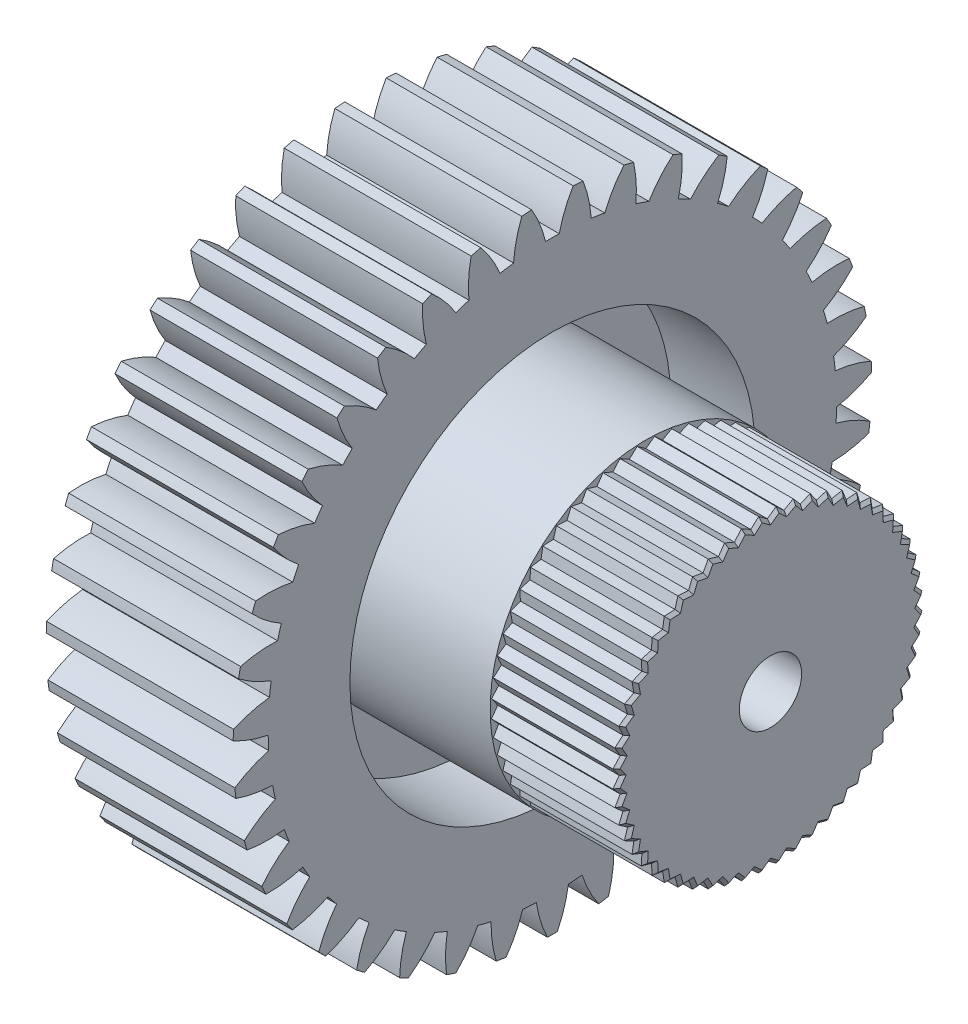
from build123d import *

# Parameters (mm, degrees)
CUT_EXTRUDE1_START         = -3
CUT_EXTRUDE1_OUTLINE_R     = 3.25
CUT_EXTRUDE1_DEPTH         = 3
CUT_EXTRUDE1_2_OUTLINE_R   = 3.25
CUT_EXTRUDE1_2_OUTLINE_R_2 = 0.5
CUT_EXTRUDE1_2_DEPTH       = 1.65
BOSS_EXTRUDE1_DEPTH        = 3.5
BOSS_EXTRUDE1_DEPTH_BACK   = 1.35
SKETCH1_3_R                = 2.5
CUT_EXTRUDE2_START         = 12.698683895
CUT_EXTRUDE2_DEPTH         = 14.698683895
CIRPATTERN1_COUNT          = 56
CHAMFER1_SIZE              = 0.05
SKETCH3_R                  = 0.5
CUT_EXTRUDE3_DEPTH         = 11.868841009


with BuildPart() as part:
    # Cut-Extrude1: read off the stored shape, not the designer's step
    # Cut-Extrude1 outline → Cut-Extrude1 (new body)
    with BuildSketch(Plane(origin=(-2.041991576, 0, 0), x_dir=(0, 0, -1), z_dir=(1, 0, 0)).offset(CUT_EXTRUDE1_START)):
        with BuildLine():
            ThreePointArc((-4.542003654, 3.054318536), (-4.545821817, 2.974892192), (-4.5484072, 2.895416169))
            ThreePointArc((-4.5484072, 2.895416169), (-4.274874018, 2.773395648), (-3.985880759, 2.694704447))
            ThreePointArc((-3.985880759, 2.694704447), (-3.982778816, 2.584856163), (-3.977031586, 2.47511448))
            ThreePointArc((-3.977031586, 2.47511448), (-4.258755718, 2.373424154), (-4.521583343, 2.229789032))
            ThreePointArc((-4.521583343, 2.229789032), (-4.512611181, 2.150778762), (-4.502414234, 2.071917208))
            ThreePointArc((-4.502414234, 2.071917208), (-4.212849767, 1.99535463), (-3.914975938, 1.964040238))
            ThreePointArc((-3.914975938, 1.964040238), (-3.89429326, 1.856112047), (-3.871016652, 1.74871341))
            ThreePointArc((-3.871016652, 1.74871341), (-4.132780255, 1.603148219), (-4.369163637, 1.419212618))
            ThreePointArc((-4.369163637, 1.419212618), (-4.347633523, 1.342664746), (-4.324918341, 1.266460134))
            ThreePointArc((-4.324918341, 1.266460134), (-4.026822157, 1.237338427), (-3.727782534, 1.254211871))
            ThreePointArc((-3.727782534, 1.254211871), (-3.690054792, 1.150999057), (-3.649851656, 1.048725035))
            ThreePointArc((-3.649851656, 1.048725035), (-3.884875191, 0.86305504), (-4.088692125, 0.643582795))
            ThreePointArc((-4.088692125, 0.643582795), (-4.055161678, 0.571479872), (-4.020516572, 0.499905861))
            ThreePointArc((-4.020516572, 0.499905861), (-3.721609205, 0.518979263), (-3.429148758, 0.583603529))
            ThreePointArc((-3.429148758, 0.583603529), (-3.37535308, 0.487779249), (-3.319264658, 0.393278685))
            ThreePointArc((-3.319264658, 0.393278685), (-3.521461138, 0.172312641), (-3.687432872, -0.077012031))
            ThreePointArc((-3.687432872, -0.077012031), (-3.642770514, -0.142802579), (-3.597092774, -0.207892259))
            ThreePointArc((-3.597092774, -0.207892259), (-3.305115768, -0.141117738), (-3.026809068, -0.030416384))
            ThreePointArc((-3.026809068, -0.030416384), (-2.958338734, -0.116370331), (-2.887817686, -0.200649922))
            ThreePointArc((-2.887817686, -0.200649922), (-3.051950328, -0.45118911), (-3.175778283, -0.723908832))
            ThreePointArc((-3.175778283, -0.723908832), (-3.121140744, -0.781683063), (-3.065613399, -0.838602624))
            ThreePointArc((-3.065613399, -0.838602624), (-2.788128805, -0.725856411), (-2.53118385, -0.571945076))
            ThreePointArc((-2.53118385, -0.571945076), (-2.449812206, -0.645802529), (-2.36668499, -0.717678349))
            ThreePointArc((-2.36668499, -0.717678349), (-2.488502846, -0.991301847), (-2.566979941, -1.280353321))
            ThreePointArc((-2.566979941, -1.280353321), (-2.503782306, -1.328614914), (-2.439843486, -1.375890169))
            ThreePointArc((-2.439843486, -1.375890169), (-2.184038009, -1.22009233), (-1.955109537, -1.026957238))
            ThreePointArc((-1.955109537, -1.026957238), (-1.862944067, -1.086805326), (-1.769363634, -1.14441583))
            ThreePointArc((-1.769363634, -1.14441583), (-1.845711684, -1.434036935), (-1.876805404, -1.731933879))
            ThreePointArc((-1.876805404, -1.731933879), (-1.806684458, -1.769432883), (-1.735990145, -1.805839428))
            ThreePointArc((-1.735990145, -1.805839428), (-1.508489012, -1.611025046), (-1.313506152, -1.383668293))
            ThreePointArc((-1.313506152, -1.383668293), (-1.212933892, -1.427956983), (-1.111323926, -1.469810089))
            ThreePointArc((-1.111323926, -1.469810089), (-1.140224797, -1.767927765), (-1.123129831, -2.066954806))
            ThreePointArc((-1.123129831, -2.066954806), (-1.047901669, -2.092720016), (-0.972282808, -2.117314941))
            ThreePointArc((-0.972282808, -2.117314941), (-0.77897818, -1.888529606), (-0.622990885, -1.632839613))
            ThreePointArc((-0.622990885, -1.632839613), (-0.516616604, -1.660421851), (-0.40960875, -1.685433586))
            ThreePointArc((-0.40960875, -1.685433586), (-0.390313924, -1.984326742), (-0.325473023, -2.276739235))
            ThreePointArc((-0.325473023, -2.276739235), (-0.247086016, -2.290103347), (-0.168501096, -2.302249656))
            ThreePointArc((-0.168501096, -2.302249656), (-0.01439946, -2.045418788), (0.098552281, -1.768017791))
            ThreePointArc((0.098552281, -1.768017791), (0.207973546, -1.778179212), (0.31760784, -1.785701784))
            ThreePointArc((0.31760784, -1.785701784), (0.384598637, -2.077629244), (0.495506128, -2.355853861))
            ThreePointArc((0.495506128, -2.355853861), (0.575021799, -2.356470751), (0.65453747, -2.355853861))
            ThreePointArc((0.65453747, -2.355853861), (0.765444961, -2.077629244), (0.832435758, -1.785701784))
            ThreePointArc((0.832435758, -1.785701784), (0.942070052, -1.778179212), (1.051491317, -1.768017791))
            ThreePointArc((1.051491317, -1.768017791), (1.164443059, -2.045418788), (1.318544694, -2.302249656))
            ThreePointArc((1.318544694, -2.302249656), (1.397129614, -2.290103347), (1.475516621, -2.276739235))
            ThreePointArc((1.475516621, -2.276739235), (1.540357522, -1.984326742), (1.559652348, -1.685433586))
            ThreePointArc((1.559652348, -1.685433586), (1.666660202, -1.660421851), (1.773034483, -1.632839613))
            ThreePointArc((1.773034483, -1.632839613), (1.929021779, -1.888529606), (2.122326407, -2.117314941))
            ThreePointArc((2.122326407, -2.117314941), (2.197945267, -2.092720016), (2.273173429, -2.066954806))
            ThreePointArc((2.273173429, -2.066954806), (2.290268395, -1.767927765), (2.261367524, -1.469810089))
            ThreePointArc((2.261367524, -1.469810089), (2.36297749, -1.427956983), (2.46354975, -1.383668293))
            ThreePointArc((2.46354975, -1.383668293), (2.65853261, -1.611025046), (2.886033743, -1.805839428))
            ThreePointArc((2.886033743, -1.805839428), (2.956728056, -1.769432883), (3.026849002, -1.731933879))
            ThreePointArc((3.026849002, -1.731933879), (2.995755282, -1.434036935), (2.919407232, -1.14441583))
            ThreePointArc((2.919407232, -1.14441583), (3.012987665, -1.086805326), (3.105153135, -1.026957238))
            ThreePointArc((3.105153135, -1.026957238), (3.334081607, -1.22009233), (3.589887084, -1.375890169))
            ThreePointArc((3.589887084, -1.375890169), (3.653825904, -1.328614914), (3.717023539, -1.280353321))
            ThreePointArc((3.717023539, -1.280353321), (3.638546444, -0.991301847), (3.516728588, -0.717678349))
            ThreePointArc((3.516728588, -0.717678349), (3.599855805, -0.645802529), (3.681227448, -0.571945076))
            ThreePointArc((3.681227448, -0.571945076), (3.938172403, -0.725856411), (4.215656998, -0.838602624))
            ThreePointArc((4.215656998, -0.838602624), (4.271184342, -0.781683063), (4.325821881, -0.723908832))
            ThreePointArc((4.325821881, -0.723908832), (4.201993926, -0.45118911), (4.037861284, -0.200649922))
            ThreePointArc((4.037861284, -0.200649922), (4.108382332, -0.116370331), (4.176852666, -0.030416384))
            ThreePointArc((4.176852666, -0.030416384), (4.455159366, -0.141117738), (4.747136372, -0.207892259))
            ThreePointArc((4.747136372, -0.207892259), (4.792814112, -0.142802578), (4.837476471, -0.077012031))
            ThreePointArc((4.837476471, -0.077012031), (4.671504736, 0.172312641), (4.469308256, 0.393278685))
            ThreePointArc((4.469308256, 0.393278685), (4.525396678, 0.487779249), (4.579192356, 0.583603529))
            ThreePointArc((4.579192356, 0.583603529), (4.871652803, 0.518979263), (5.17056017, 0.499905861))
            ThreePointArc((5.17056017, 0.499905861), (5.205205276, 0.571479872), (5.238735723, 0.643582795))
            ThreePointArc((5.238735723, 0.643582795), (5.034918789, 0.86305504), (4.799895255, 1.048725035))
            ThreePointArc((4.799895255, 1.048725035), (4.84009839, 1.150999057), (4.877826132, 1.254211871))
            ThreePointArc((4.877826132, 1.254211871), (5.176865755, 1.237338427), (5.474961939, 1.266460134))
            ThreePointArc((5.474961939, 1.266460134), (5.497677121, 1.342664746), (5.519207235, 1.419212618))
            ThreePointArc((5.519207235, 1.419212618), (5.282823853, 1.603148219), (5.02106025, 1.74871341))
            ThreePointArc((5.02106025, 1.74871341), (5.044336858, 1.856112047), (5.065019536, 1.964040238))
            ThreePointArc((5.065019536, 1.964040238), (5.362893365, 1.99535463), (5.652457832, 2.071917208))
            ThreePointArc((5.652457832, 2.071917208), (5.662654779, 2.150778762), (5.671626942, 2.229789032))
            ThreePointArc((5.671626942, 2.229789032), (5.408799316, 2.373424154), (5.127075184, 2.47511448))
            ThreePointArc((5.127075184, 2.47511448), (5.132822414, 2.584856163), (5.135924358, 2.694704447))
            ThreePointArc((5.135924358, 2.694704447), (5.424917617, 2.773395648), (5.698450798, 2.895416169))
            ThreePointArc((5.698450798, 2.895416169), (5.695865415, 2.974892192), (5.692047252, 3.054318536))
            ThreePointArc((5.692047252, 3.054318536), (5.409582482, 3.153933105), (5.115194328, 3.209114838))
            ThreePointArc((5.115194328, 3.209114838), (5.103263328, 3.318357316), (5.088704198, 3.427280681))
            ThreePointArc((5.088704198, 3.427280681), (5.361332114, 3.55131063), (5.611749645, 3.715628825))
            ThreePointArc((5.611749645, 3.715628825), (5.596448891, 3.793660929), (5.579939291, 3.871446246))
            ThreePointArc((5.579939291, 3.871446246), (5.285153064, 3.924460297), (4.985725387, 3.931704261))
            ThreePointArc((4.985725387, 3.931704261), (4.956425165, 4.037618211), (4.924582036, 4.142795598))
            ThreePointArc((4.924582036, 4.142795598), (5.173783689, 4.308951985), (5.394599886, 4.511312099))
            ThreePointArc((5.394599886, 4.511312099), (5.366980043, 4.585879295), (5.338206595, 4.660008986))
            ThreePointArc((5.338206595, 4.660008986), (5.038733721, 4.665049483), (4.74202154, 4.624168062))
            ThreePointArc((4.74202154, 4.624168062), (4.696110957, 4.724010368), (4.647808548, 4.822717738))
            ThreePointArc((4.647808548, 4.822717738), (4.867129746, 5.0266972), (5.052625586, 5.261858213))
            ThreePointArc((5.052625586, 5.261858213), (5.013401993, 5.331029249), (4.973109916, 5.399583395))
            ThreePointArc((4.973109916, 5.399583395), (4.676706584, 5.356519791), (4.390394589, 5.268571793))
            ThreePointArc((4.390394589, 5.268571793), (4.329062703, 5.359756591), (4.265552022, 5.449437476))
            ThreePointArc((4.265552022, 5.449437476), (4.449312462, 5.685957052), (4.594683701, 5.947828417))
            ThreePointArc((4.594683701, 5.947828417), (4.544872228, 6.009811799), (4.494105064, 6.071014883))
            ThreePointArc((4.494105064, 6.071014883), (4.208447966, 5.980962503), (3.939951487, 5.848225735))
            ThreePointArc((3.939951487, 5.848225735), (3.864786763, 5.928391387), (3.787712703, 6.006723098))
            ThreePointArc((3.787712703, 6.006723098), (3.931153085, 6.269657055), (4.032634683, 6.551456442))
            ThreePointArc((4.032634683, 6.551456442), (3.973525423, 6.604646833), (3.913598015, 6.656913727))
            ThreePointArc((3.913598015, 6.656913727), (3.646085518, 6.522204882), (3.402358473, 6.348117155))
            ThreePointArc((3.402358473, 6.348117155), (3.315307637, 6.415187414), (3.226666376, 6.480141201))
            ThreePointArc((3.226666376, 6.480141201), (3.32607167, 6.762679688), (3.381035308, 7.057108639))
            ThreePointArc((3.381035308, 7.057108639), (3.314159158, 7.100128437), (3.246623595, 7.142105457))
            ThreePointArc((3.246623595, 7.142105457), (3.004184134, 6.966229033), (2.791538925, 6.755299129))
            ThreePointArc((2.791538925, 6.755299129), (2.694856548, 6.80753691), (2.596943848, 6.857430504))
            ThreePointArc((2.596943848, 6.857430504), (2.649739509, 7.152255922), (2.656761657, 7.451688884))
            ThreePointArc((2.656761657, 7.451688884), (2.583850675, 7.483423898), (2.510456092, 7.514023859))
            ThreePointArc((2.510456092, 7.514023859), (2.29936872, 7.301534965), (2.123312747, 7.059225858))
            ThreePointArc((2.123312747, 7.059225858), (2.019502853, 7.095278229), (1.914854601, 7.128819413))
            ThreePointArc((1.914854601, 7.128819413), (1.919673249, 7.428295938), (1.878572037, 7.724977753))
            ThreePointArc((1.878572037, 7.724977753), (1.801514579, 7.744606063), (1.724161857, 7.763036444))
            ThreePointArc((1.724161857, 7.763036444), (1.549893628, 7.519438429), (1.414986647, 7.252025798))
            ThreePointArc((1.414986647, 7.252025798), (1.306737857, 7.270959022), (1.198064388, 7.287279096))
            ThreePointArc((1.198064388, 7.287279096), (1.154781223, 7.583650445), (1.066621151, 7.86989721))
            ThreePointArc((1.066621151, 7.86989721), (0.987412964, 7.876910453), (0.908105499, 7.882693917))
            ThreePointArc((0.908105499, 7.882693917), (0.775169867, 7.614295842), (0.684905899, 7.328705532))
            ThreePointArc((0.684905899, 7.328705532), (0.575021799, 7.330029249), (0.465137699, 7.328705532))
            ThreePointArc((0.465137699, 7.328705532), (0.374873732, 7.614295842), (0.241938099, 7.882693917))
            ThreePointArc((0.241938099, 7.882693917), (0.162630634, 7.876910453), (0.083422448, 7.86989721))
            ThreePointArc((0.083422448, 7.86989721), (-0.004737624, 7.583650445), (-0.04802079, 7.287279096))
            ThreePointArc((-0.04802079, 7.287279096), (-0.156694259, 7.270959022), (-0.264943049, 7.252025798))
            ThreePointArc((-0.264943049, 7.252025798), (-0.399850029, 7.519438429), (-0.574118259, 7.763036444))
            ThreePointArc((-0.574118259, 7.763036444), (-0.65147098, 7.744606063), (-0.728528439, 7.724977753))
            ThreePointArc((-0.728528439, 7.724977753), (-0.769629651, 7.428295938), (-0.764811003, 7.128819413))
            ThreePointArc((-0.764811003, 7.128819413), (-0.869459255, 7.095278229), (-0.973269149, 7.059225858))
            ThreePointArc((-0.973269149, 7.059225858), (-1.149325122, 7.301534965), (-1.360412494, 7.514023859))
            ThreePointArc((-1.360412494, 7.514023859), (-1.433807077, 7.483423898), (-1.506718059, 7.451688884))
            ThreePointArc((-1.506718059, 7.451688884), (-1.499695911, 7.152255922), (-1.44690025, 6.857430504))
            ThreePointArc((-1.44690025, 6.857430504), (-1.54481295, 6.80753691), (-1.641495327, 6.755299129))
            ThreePointArc((-1.641495327, 6.755299129), (-1.854140535, 6.966229033), (-2.096579997, 7.142105457))
            ThreePointArc((-2.096579997, 7.142105457), (-2.16411556, 7.100128437), (-2.23099171, 7.057108639))
            ThreePointArc((-2.23099171, 7.057108639), (-2.176028072, 6.762679688), (-2.076622778, 6.480141201))
            ThreePointArc((-2.076622778, 6.480141201), (-2.165264039, 6.415187414), (-2.252314875, 6.348117155))
            ThreePointArc((-2.252314875, 6.348117155), (-2.49604192, 6.522204882), (-2.763554417, 6.656913727))
            ThreePointArc((-2.763554417, 6.656913727), (-2.823481824, 6.604646833), (-2.882591085, 6.551456442))
            ThreePointArc((-2.882591085, 6.551456442), (-2.781109486, 6.269657056), (-2.637669105, 6.006723098))
            ThreePointArc((-2.637669105, 6.006723098), (-2.714743164, 5.928391387), (-2.789907889, 5.848225735))
            ThreePointArc((-2.789907889, 5.848225735), (-3.058404368, 5.980962503), (-3.344061466, 6.071014883))
            ThreePointArc((-3.344061466, 6.071014883), (-3.39482863, 6.009811799), (-3.444640102, 5.947828417))
            ThreePointArc((-3.444640102, 5.947828417), (-3.299268864, 5.685957052), (-3.115508424, 5.449437476))
            ThreePointArc((-3.115508424, 5.449437476), (-3.179019105, 5.359756591), (-3.240350991, 5.268571793))
            ThreePointArc((-3.240350991, 5.268571793), (-3.526662986, 5.356519791), (-3.823066318, 5.399583395))
            ThreePointArc((-3.823066318, 5.399583395), (-3.863358395, 5.331029249), (-3.902581988, 5.261858213))
            ThreePointArc((-3.902581988, 5.261858213), (-3.717086148, 5.0266972), (-3.49776495, 4.822717738))
            ThreePointArc((-3.49776495, 4.822717738), (-3.546067358, 4.724010367), (-3.591977942, 4.624168062))
            ThreePointArc((-3.591977942, 4.624168062), (-3.888690123, 4.665049483), (-4.188162997, 4.660008986))
            ThreePointArc((-4.188162997, 4.660008986), (-4.216936445, 4.585879295), (-4.244556288, 4.511312099))
            ThreePointArc((-4.244556288, 4.511312099), (-4.023740091, 4.308951985), (-3.774538438, 4.142795598))
            ThreePointArc((-3.774538438, 4.142795598), (-3.806381567, 4.037618211), (-3.835681789, 3.931704261))
            ThreePointArc((-3.835681789, 3.931704261), (-4.135109466, 3.924460297), (-4.429895692, 3.871446246))
            ThreePointArc((-4.429895692, 3.871446246), (-4.446405293, 3.793660929), (-4.461706047, 3.715628825))
            ThreePointArc((-4.461706047, 3.715628825), (-4.211288516, 3.55131063), (-3.9386606, 3.427280681))
            ThreePointArc((-3.9386606, 3.427280681), (-3.95321973, 3.318357316), (-3.965150729, 3.209114838))
            ThreePointArc((-3.965150729, 3.209114838), (-4.259538883, 3.153933105), (-4.542003654, 3.054318536))
        make_face()
        with Locations((0.575021799, 2.768529249)):
            Circle(CUT_EXTRUDE1_OUTLINE_R, mode=Mode.SUBTRACT)
    extrude(amount=CUT_EXTRUDE1_DEPTH)

    # Cut-Extrude1 2 outline → Cut-Extrude1 2 (add)
    with BuildSketch(Plane(origin=(-2.041991576, 0, 0), x_dir=(0, 0, -1), z_dir=(1, 0, 0)).offset(CUT_EXTRUDE1_START)):
        with Locations((0.575021799, 2.768529249)):
            Circle(CUT_EXTRUDE1_2_OUTLINE_R)
        with Locations((0.575021799, 2.768529249)):
            Circle(CUT_EXTRUDE1_2_OUTLINE_R_2, mode=Mode.SUBTRACT)
    extrude(amount=CUT_EXTRUDE1_2_DEPTH)

    # Sketch1<3> → Boss-Extrude1 (add, two sides: drawn at the far end of the back side and taken through both)
    with BuildSketch(Plane(origin=(-2.041991576, 0, 0), x_dir=(0, 0, -1), z_dir=(1, 0, 0)).offset(-BOSS_EXTRUDE1_DEPTH_BACK)):
        with Locations((0.575021799, 2.768529249)):
            Circle(SKETCH1_3_R)
    extrude(amount=BOSS_EXTRUDE1_DEPTH + BOSS_EXTRUDE1_DEPTH_BACK)

    # Sketch2 → Cut-Extrude2 (cut)
    with BuildSketch(Plane(origin=(1.458008424, 0, 0), x_dir=(0, 0, -1), z_dir=(1, 0, 0)).offset(CUT_EXTRUDE2_START)):
        with BuildLine():
            Line((0.412975905, 5.263271947), (0.575021799, 5.146049388))
            Line((0.575021799, 5.146049388), (0.737067693, 5.263271947))
            ThreePointArc((0.737067693, 5.263271947), (0.575021799, 5.268529249), (0.412975905, 5.263271947))
        make_face()
    cut_extrude2 = extrude(amount=-CUT_EXTRUDE2_DEPTH, mode=Mode.SUBTRACT)

    # CirPattern1: Cut-Extrude2 ×56 about axis
    cirpattern1_axis = Axis((-3.391991576, 2.768529249, -0.575021799), (1, 0, 0))
    for i in range(1, CIRPATTERN1_COUNT):
        add(cut_extrude2.rotate(cirpattern1_axis, i * 360 / CIRPATTERN1_COUNT), mode=Mode.SUBTRACT)

    # Chamfer1
    chamfer1_edges = [part.edges().sort_by_distance(p)[0] for p in [
        (1.458008424, 4.227869361, 1.366540516),
        (1.458008424, 4.119148069, 1.443682386),
        (1.458008424, 4.001307329, 1.517726631),
        (1.458008424, 3.884632505, 1.582210527),
        (1.458008424, 3.759242398, 1.64259522),
        (1.458008424, 3.636081295, 1.693610219),
        (1.458008424, 3.504718674, 1.739575988),
        (1.458008424, 3.376620114, 1.776480547),
        (1.458008424, 3.240936941, 1.807449346),
        (1.458008424, 3.109511838, 1.829779369),
        (1.458008424, 2.971214407, 1.845361748),
        (1.458008424, 2.838115508, 1.852836421),
        (1.458008424, 2.698942989, 1.852836421),
        (1.458008424, 2.565844091, 1.845361748),
        (1.458008424, 2.427546659, 1.829779369),
        (1.458008424, 2.296121557, 1.807449346),
        (1.458008424, 2.160438383, 1.776480547),
        (1.458008424, 2.032339824, 1.739575988),
        (1.458008424, 1.900977203, 1.693610219),
        (1.458008424, 1.7778161, 1.64259522),
        (1.458008424, 1.652425993, 1.582210527),
        (1.458008424, 1.535751168, 1.517726631),
        (1.458008424, 1.417910428, 1.443682386),
        (1.458008424, 1.309189136, 1.366540516),
        (1.458008424, 1.20037968, 1.279767869),
        (1.458008424, 1.100979153, 1.190938128),
        (1.458008424, 1.002569321, 1.092528296),
        (1.458008424, 0.91373958, 0.99312777),
        (1.458008424, 0.826966934, 0.884318313),
        (1.458008424, 0.749825063, 0.775597021),
        (1.458008424, 0.675780819, 0.657756282),
        (1.458008424, 0.611296923, 0.541081457),
        (1.458008424, 0.55091223, 0.41569135),
        (1.458008424, 0.499897231, 0.292530247),
        (1.458008424, 0.453931462, 0.161167626),
        (1.458008424, 0.417026902, 0.033069066),
        (1.458008424, 0.386058103, -0.102614107),
        (1.458008424, 0.36372808, -0.23403921),
        (1.458008424, 0.348145702, -0.372336641),
        (1.458008424, 0.340671028, -0.50543554),
        (1.458008424, 0.340671028, -0.644608059),
        (1.458008424, 0.348145702, -0.777706957),
        (1.458008424, 0.36372808, -0.916004389),
        (1.458008424, 0.386058103, -1.047429491),
        (1.458008424, 0.417026902, -1.183112665),
        (1.458008424, 0.453931462, -1.311211224),
        (1.458008424, 0.499897231, -1.442573845),
        (1.458008424, 0.55091223, -1.565734948),
        (1.458008424, 0.611296923, -1.691125055),
        (1.458008424, 0.675780819, -1.80779988),
        (1.458008424, 0.749825063, -1.92564062),
        (1.458008424, 0.826966934, -2.034361911),
        (1.458008424, 0.91373958, -2.143171368),
        (1.458008424, 1.002569321, -2.242571895),
        (1.458008424, 1.100979153, -2.340981727),
        (1.458008424, 1.20037968, -2.429811468),
        (1.458008424, 1.309189136, -2.516584114),
        (1.458008424, 1.417910428, -2.593725985),
        (1.458008424, 1.535751168, -2.667770229),
        (1.458008424, 1.652425993, -2.732254125),
        (1.458008424, 1.7778161, -2.792638818),
        (1.458008424, 1.900977203, -2.843653817),
        (1.458008424, 2.032339824, -2.889619586),
        (1.458008424, 2.160438383, -2.926524146),
        (1.458008424, 2.296121557, -2.957492945),
        (1.458008424, 2.427546659, -2.979822968),
        (1.458008424, 2.565844091, -2.995405346),
        (1.458008424, 2.698942989, -3.00288002),
        (1.458008424, 2.838115508, -3.00288002),
        (1.458008424, 2.971214407, -2.995405346),
        (1.458008424, 3.109511838, -2.979822968),
        (1.458008424, 3.240936941, -2.957492945),
        (1.458008424, 3.376620114, -2.926524146),
        (1.458008424, 3.504718674, -2.889619586),
        (1.458008424, 3.636081295, -2.843653817),
        (1.458008424, 3.759242398, -2.792638818),
        (1.458008424, 3.884632505, -2.732254125),
        (1.458008424, 4.001307329, -2.667770229),
        (1.458008424, 4.119148069, -2.593725985),
        (1.458008424, 4.227869361, -2.516584114),
        (1.458008424, 4.336678818, -2.429811468),
        (1.458008424, 4.436079344, -2.340981727),
        (1.458008424, 4.534489176, -2.242571895),
        (1.458008424, 4.623318917, -2.143171368),
        (1.458008424, 4.710091564, -2.034361911),
        (1.458008424, 4.787233434, -1.92564062),
        (1.458008424, 4.861277679, -1.80779988),
        (1.458008424, 4.925761575, -1.691125055),
        (1.458008424, 4.986146268, -1.565734948),
        (1.458008424, 5.037161267, -1.442573845),
        (1.458008424, 5.083127036, -1.311211224),
        (1.458008424, 5.120031595, -1.183112665),
        (1.458008424, 5.151000394, -1.047429491),
        (1.458008424, 5.173330417, -0.916004389),
        (1.458008424, 5.188912796, -0.777706957),
        (1.458008424, 5.196387469, -0.644608059),
        (1.458008424, 5.196387469, -0.50543554),
        (1.458008424, 5.188912796, -0.372336641),
        (1.458008424, 5.173330417, -0.23403921),
        (1.458008424, 5.151000394, -0.102614107),
        (1.458008424, 5.120031595, 0.033069066),
        (1.458008424, 5.083127036, 0.161167626),
        (1.458008424, 5.037161267, 0.292530247),
        (1.458008424, 4.986146268, 0.41569135),
        (1.458008424, 4.925761575, 0.541081457),
        (1.458008424, 4.861277679, 0.657756282),
        (1.458008424, 4.787233434, 0.775597021),
        (1.458008424, 4.710091564, 0.884318313),
        (1.458008424, 4.623318917, 0.99312777),
        (1.458008424, 4.534489176, 1.092528296),
        (1.458008424, 4.436079344, 1.190938128),
        (1.458008424, 4.336678818, 1.279767869),
    ]]
    chamfer(chamfer1_edges, length=CHAMFER1_SIZE)

    # Sketch3 → Cut-Extrude3 (cut, through all)
    with BuildSketch(Plane.ZY.offset(3.391991576)):
        with Locations((-0.575021799, 2.768529249)):
            Circle(SKETCH3_R)
    extrude(amount=-CUT_EXTRUDE3_DEPTH, mode=Mode.SUBTRACT)


solid = part.part
